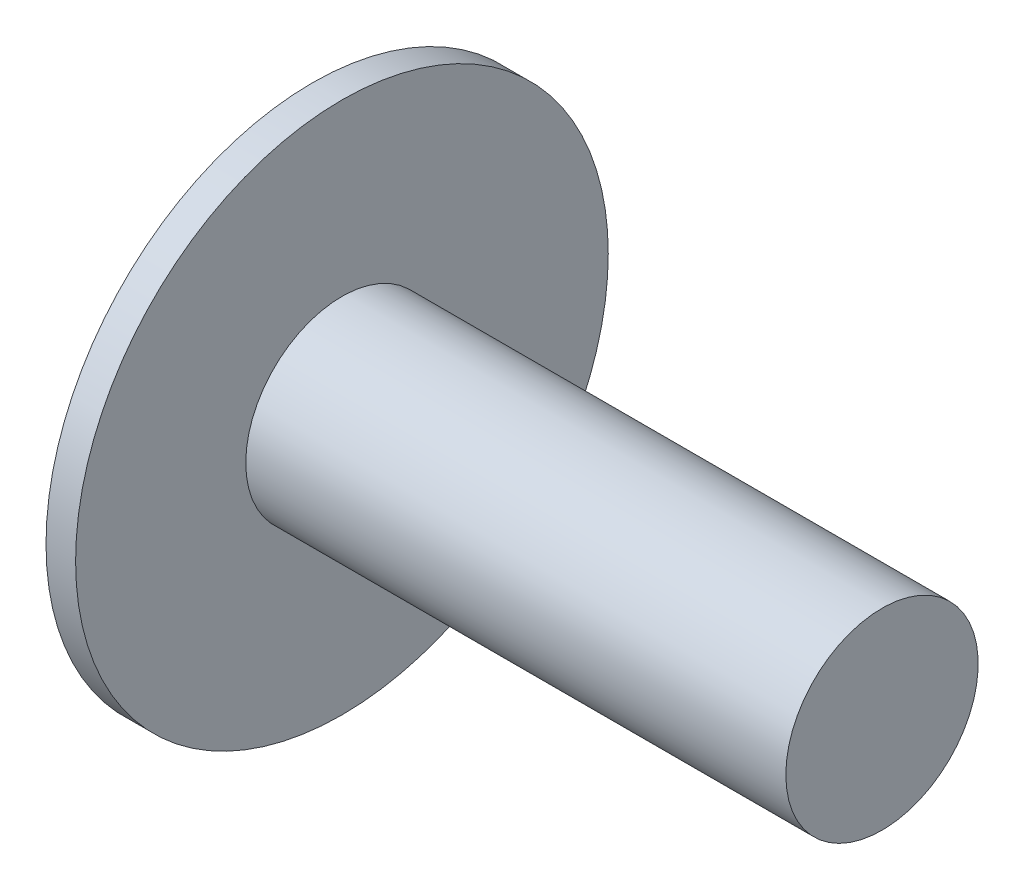
from build123d import *


with BuildPart() as part:
    # Sketch1 → Revolve1 (revolve)
    with BuildSketch(Plane.XY):
        Polygon((0, 6.5), (36.5, 6.5), (36.5, 0), (-2, 0), (-2, 18), (0, 18), align=None)
    revolve(axis=Axis((-29.661319917, 0, 0), (1, 0, 0)))


solid = part.part
